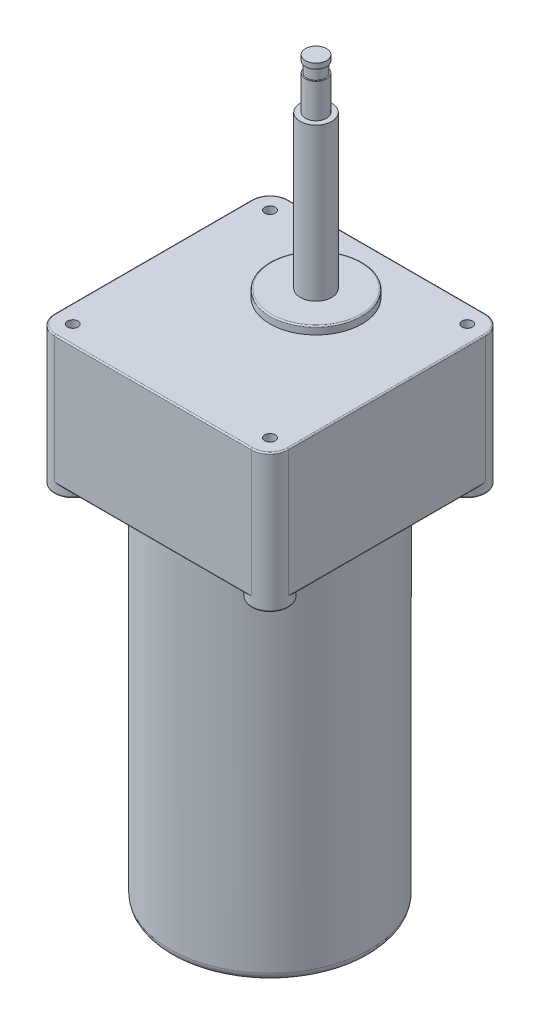
from build123d import *

# Parameters (mm, degrees)
SKETCH1_R           = 38
BOSS_EXTRUDE1_DEPTH = 141
FILLET1_R           = 3
SKETCH2_W           = 89
SKETCH2_H           = 89
BOSS_EXTRUDE2_DEPTH = 49
FILLET2_R           = 7
BOSS_EXTRUDE3_DEPTH = 3.5
FILLET3_R           = 0.5
SKETCH3_R           = 2
CUT_EXTRUDE3_DEPTH  = 201.151192896
SKETCH5_R           = 6
BOSS_EXTRUDE4_DEPTH = 80
SKETCH6_OUTSIDE_W   = 150.58
SKETCH6_OUTSIDE_H   = 150.58
SKETCH6_OUTSIDE_R   = 4
CUT_EXTRUDE4_DEPTH  = 19
SKETCH7_OUTSIDE_W   = 150.58
SKETCH7_OUTSIDE_H   = 150.58
SKETCH7_OUTSIDE_R   = 3.5
CUT_EXTRUDE5_DEPTH  = 4
SKETCH8_R           = 17.5
BOSS_EXTRUDE5_DEPTH = 3
FILLET4_R           = 0.5


with BuildPart() as part:
    # Sketch1 → Boss-Extrude1 (new body)
    with BuildSketch(Plane(origin=(0, 0, 0), x_dir=(1, 0, 0), z_dir=(0, 1, 0))):
        with Locations(Location((0, 0, 0), (0, 0, 270))):
            Circle(SKETCH1_R)
    extrude(amount=BOSS_EXTRUDE1_DEPTH)

    # Fillet1
    fillet1_edges = [part.edges().sort_by_distance(p)[0] for p in [
        (0, 0, -38),
    ]]
    fillet(fillet1_edges, radius=FILLET1_R)

    # Sketch2 → Boss-Extrude2 (add)
    with BuildSketch(Plane(origin=(0, 141, 0), x_dir=(1, 0, 0), z_dir=(0, 1, 0))):
        Rectangle(SKETCH2_W, SKETCH2_H)
    extrude(amount=BOSS_EXTRUDE2_DEPTH)

    # Fillet2
    fillet2_edges = [part.edges().sort_by_distance(p)[0] for p in [
        (44.5, 165.5, 44.5),
        (44.5, 165.5, -44.5),
        (-44.5, 165.5, -44.5),
        (-44.5, 165.5, 44.5),
    ]]
    fillet(fillet2_edges, radius=FILLET2_R)

    # Sketch4 → Boss-Extrude3 (add)
    with BuildSketch(Plane.XZ.offset(-141)):
        with BuildLine():
            Line((-42.449747468, 32.550252532), (-31.359972761, 21.460477824))
            ThreePointArc((-31.359972761, 21.460477824), (-26.870057685, 26.870057685), (-21.460477824, 31.359972761))
            Line((-21.460477824, 31.359972761), (-32.550252532, 42.449747468))
            ThreePointArc((-32.550252532, 42.449747468), (-42.449747468, 42.449747468), (-42.449747468, 32.550252532))
        make_face()
        with BuildLine():
            Line((32.550252532, 42.449747468), (21.460477824, 31.359972761))
            ThreePointArc((21.460477824, 31.359972761), (26.870057685, 26.870057685), (31.359972761, 21.460477824))
            Line((31.359972761, 21.460477824), (42.449747468, 32.550252532))
            ThreePointArc((42.449747468, 32.550252532), (42.449747468, 42.449747468), (32.550252532, 42.449747468))
        make_face()
        with BuildLine():
            Line((42.449747468, -32.550252532), (31.359972761, -21.460477824))
            ThreePointArc((31.359972761, -21.460477824), (26.870057685, -26.870057685), (21.460477824, -31.359972761))
            Line((21.460477824, -31.359972761), (32.550252532, -42.449747468))
            ThreePointArc((32.550252532, -42.449747468), (42.449747468, -42.449747468), (42.449747468, -32.550252532))
        make_face()
        with BuildLine():
            Line((-32.550252532, -42.449747468), (-21.460477824, -31.359972761))
            ThreePointArc((-21.460477824, -31.359972761), (-26.870057685, -26.870057685), (-31.359972761, -21.460477824))
            Line((-31.359972761, -21.460477824), (-42.449747468, -32.550252532))
            ThreePointArc((-42.449747468, -32.550252532), (-42.449747468, -42.449747468), (-32.550252532, -42.449747468))
        make_face()
    extrude(amount=BOSS_EXTRUDE3_DEPTH)

    # Fillet3
    # the kernel refuses this fillet: 0.5 mm, written as the material it takes off along each edge
    with BuildSketch(Plane(origin=(44.5, 141, -38.75), x_dir=(0, 1, 0), z_dir=(0, 0, 1))) as fillet3_piece_1_section:
        with BuildLine():
            CenterArc((FILLET3_R, FILLET3_R), FILLET3_R, 180, 90)
            Line((0, FILLET3_R), (0, 0))
            Line((0, 0), (FILLET3_R, 0))
        make_face()
    fillet3_piece_1 = extrude(amount=77.5, mode=Mode.PRIVATE)
    fillet3_piece_1 = fillet3_piece_1 - Plane(origin=(37.5, 141.115144567, 37.5), x_dir=(0, 0, 1), z_dir=(0, 1, 0)) * Cylinder(7, 157, mode=Mode.PRIVATE)
    fillet3_piece_1 = fillet3_piece_1 - Plane(origin=(37.5, 141.115144567, -37.5), x_dir=(1, 0, 0), z_dir=(0, 1, 0)) * Cylinder(7, 157, mode=Mode.PRIVATE)
    add(fillet3_piece_1, mode=Mode.SUBTRACT)
    with BuildSketch(Plane(origin=(44.5, 190, -37.5), x_dir=(-1, 0, 0), z_dir=(0, 0, 1)), Plane(origin=(-44.5, 190, 37.5), x_dir=(1, 0, 0), z_dir=(0, 0, -1)), Plane(origin=(-37.5, 190, -44.5), x_dir=(0, 0, 1), z_dir=(1, 0, 0))) as fillet3_piece_2:
        with BuildLine():
            CenterArc((FILLET3_R, FILLET3_R), FILLET3_R, 180, 90)
            Line((0, FILLET3_R), (0, 0))
            Line((0, 0), (FILLET3_R, 0))
        make_face()
    extrude(amount=75, mode=Mode.SUBTRACT)
    with BuildSketch(Plane(origin=(-44.5, 141, 38.75), x_dir=(0, 1, 0), z_dir=(0, 0, -1))) as fillet3_piece_3_section:
        with BuildLine():
            CenterArc((FILLET3_R, FILLET3_R), FILLET3_R, 180, 90)
            Line((0, FILLET3_R), (0, 0))
            Line((0, 0), (FILLET3_R, 0))
        make_face()
    fillet3_piece_3 = extrude(amount=77.5, mode=Mode.PRIVATE)
    fillet3_piece_3 = fillet3_piece_3 - Plane(origin=(-37.5, 141.115144625, 37.5), x_dir=(0, 0, 1), z_dir=(0, 1, 0)) * Cylinder(7, 157, mode=Mode.PRIVATE)
    fillet3_piece_3 = fillet3_piece_3 - Plane(origin=(-37.5, 141.115144625, -37.5), x_dir=(-1, 0, 0), z_dir=(0, 1, 0)) * Cylinder(7, 157, mode=Mode.PRIVATE)
    add(fillet3_piece_3, mode=Mode.SUBTRACT)
    with BuildSketch(Plane(origin=(-38.75, 141, -44.5), x_dir=(0, 1, 0), z_dir=(1, 0, 0))) as fillet3_piece_4_section:
        with BuildLine():
            CenterArc((FILLET3_R, FILLET3_R), FILLET3_R, 180, 90)
            Line((0, FILLET3_R), (0, 0))
            Line((0, 0), (FILLET3_R, 0))
        make_face()
    fillet3_piece_4 = extrude(amount=77.5, mode=Mode.PRIVATE)
    fillet3_piece_4 = fillet3_piece_4 - Plane(origin=(37.5, 141.115144428, -37.5), x_dir=(1, 0, 0), z_dir=(0, 1, 0)) * Cylinder(7, 157, mode=Mode.PRIVATE)
    fillet3_piece_4 = fillet3_piece_4 - Plane(origin=(-37.5, 141.115144428, -37.5), x_dir=(-1, 0, 0), z_dir=(0, 1, 0)) * Cylinder(7, 157, mode=Mode.PRIVATE)
    add(fillet3_piece_4, mode=Mode.SUBTRACT)
    with BuildSketch(Plane(origin=(38.75, 141, 44.5), x_dir=(0, 1, 0), z_dir=(-1, 0, 0))) as fillet3_piece_5_section:
        with BuildLine():
            CenterArc((FILLET3_R, FILLET3_R), FILLET3_R, 180, 90)
            Line((0, FILLET3_R), (0, 0))
            Line((0, 0), (FILLET3_R, 0))
        make_face()
    fillet3_piece_5 = extrude(amount=77.5, mode=Mode.PRIVATE)
    fillet3_piece_5 = fillet3_piece_5 - Plane(origin=(37.5, 141.115144726, 37.5), x_dir=(0, 0, 1), z_dir=(0, 1, 0)) * Cylinder(7, 157, mode=Mode.PRIVATE)
    fillet3_piece_5 = fillet3_piece_5 - Plane(origin=(-37.5, 141.115144726, 37.5), x_dir=(0, 0, 1), z_dir=(0, 1, 0)) * Cylinder(7, 157, mode=Mode.PRIVATE)
    add(fillet3_piece_5, mode=Mode.SUBTRACT)
    with BuildSketch(Plane(origin=(37.5, 190, 44.5), x_dir=(0, -1, 0), z_dir=(-1, 0, 0))) as fillet3_piece_6:
        with BuildLine():
            CenterArc((FILLET3_R, -FILLET3_R), FILLET3_R, 90, 90)
            Line((0, -FILLET3_R), (0, 0))
            Line((0, 0), (FILLET3_R, 0))
        make_face()
    extrude(amount=75, mode=Mode.SUBTRACT)
    with BuildSketch(Plane(origin=(-37.5, 190, -37.5), x_dir=(-1, 0, 0), z_dir=(0, 0, 1))) as fillet3_piece_7:
        with BuildLine():
            CenterArc((7 - FILLET3_R, FILLET3_R), FILLET3_R, 270, 90)
            Line((7, FILLET3_R), (7, 0))
            Line((7, 0), (7 - FILLET3_R, 0))
        make_face()
    revolve(axis=Axis((-37.5, 190, -37.5), (0, -1, 0)), revolution_arc=90, mode=Mode.SUBTRACT)
    with BuildSketch(Plane(origin=(-37.5, 190, 37.5), x_dir=(0, 0, 1), z_dir=(1, 0, 0))) as fillet3_piece_8:
        with BuildLine():
            CenterArc((7 - FILLET3_R, FILLET3_R), FILLET3_R, 270, 90)
            Line((7 - FILLET3_R, 0), (7, 0))
            Line((7, 0), (7, FILLET3_R))
        make_face()
    revolve(axis=Axis((-37.5, 190, 37.5), (0, -1, 0)), revolution_arc=90, mode=Mode.SUBTRACT)
    with BuildSketch(Plane(origin=(37.5, 190, -37.5), x_dir=(1, 0, 0), z_dir=(0, 0, 1))) as fillet3_piece_9:
        with BuildLine():
            CenterArc((7 - FILLET3_R, -FILLET3_R), FILLET3_R, 0, 90)
            Line((7, -FILLET3_R), (7, 0))
            Line((7, 0), (7 - FILLET3_R, 0))
        make_face()
    revolve(axis=Axis((37.5, 190, -37.5), (0, 1, 0)), revolution_arc=90, mode=Mode.SUBTRACT)
    with BuildSketch(Plane(origin=(37.5, 190, 37.5), x_dir=(0, 0, 1), z_dir=(-1, 0, 0))) as fillet3_piece_10:
        with BuildLine():
            CenterArc((7 - FILLET3_R, -FILLET3_R), FILLET3_R, 0, 90)
            Line((7 - FILLET3_R, 0), (7, 0))
            Line((7, 0), (7, -FILLET3_R))
        make_face()
    revolve(axis=Axis((37.5, 190, 37.5), (0, 1, 0)), revolution_arc=90, mode=Mode.SUBTRACT)
    with BuildSketch(Plane(origin=(-20.576594348, 137.5, 30.476089284), x_dir=(0, 1, 0), z_dir=(-0.7071067811865467, 0, 0.7071067811865485))) as fillet3_piece_11_section:
        with BuildLine():
            CenterArc((FILLET3_R, FILLET3_R), FILLET3_R, 180, 90)
            Line((0, FILLET3_R), (0, 0))
            Line((0, 0), (FILLET3_R, 0))
        make_face()
    fillet3_piece_11 = extrude(amount=16.933309795, mode=Mode.PRIVATE)
    fillet3_piece_11 = fillet3_piece_11 - Plane(origin=(0, 137.613277893, 0), x_dir=(0, 0, 1), z_dir=(0, -1, 0)) * Cylinder(38, 36, mode=Mode.PRIVATE)
    add(fillet3_piece_11, mode=Mode.SUBTRACT)
    with BuildSketch(Plane(origin=(-37.5, 137.5, 37.5), x_dir=(0.7071067811865465, 0, 0.7071067811865486), z_dir=(0.7071067811865486, 0, -0.7071067811865465))) as fillet3_piece_12:
        with BuildLine():
            CenterArc((7 - FILLET3_R, -FILLET3_R), FILLET3_R, 0, 90)
            Line((7 - FILLET3_R, 0), (7, 0))
            Line((7, 0), (7, -FILLET3_R))
        make_face()
    revolve(axis=Axis((-37.5, 137.5, 37.5), (0, -1, 0)), revolution_arc=180, mode=Mode.SUBTRACT)
    with BuildSketch(Plane(origin=(-42.449747468, 137.5, 32.550252532), x_dir=(0.7071067811865476, 0, 0.7071067811865476), z_dir=(0.7071067811865476, 0, -0.7071067811865476))) as fillet3_piece_13_section:
        with BuildLine():
            CenterArc((FILLET3_R, -FILLET3_R), FILLET3_R, 90, 90)
            Line((0, -FILLET3_R), (0, 0))
            Line((0, 0), (FILLET3_R, 0))
        make_face()
    fillet3_piece_13 = extrude(amount=16.933309795, mode=Mode.PRIVATE)
    fillet3_piece_13 = fillet3_piece_13 - Plane(origin=(0, 137.613277909, 0), x_dir=(0, 0, 1), z_dir=(0, -1, 0)) * Cylinder(38, 36, mode=Mode.PRIVATE)
    add(fillet3_piece_13, mode=Mode.SUBTRACT)
    with BuildSketch(Plane(origin=(30.476089284, 137.5, 20.576594348), x_dir=(0, 1, 0), z_dir=(0.7071067811865502, 0, 0.7071067811865448))) as fillet3_piece_14_section:
        with BuildLine():
            CenterArc((FILLET3_R, FILLET3_R), FILLET3_R, 180, 90)
            Line((0, FILLET3_R), (0, 0))
            Line((0, 0), (FILLET3_R, 0))
        make_face()
    fillet3_piece_14 = extrude(amount=16.933309795, mode=Mode.PRIVATE)
    fillet3_piece_14 = fillet3_piece_14 - Plane(origin=(0, 137.613277924, 0), x_dir=(0, 0, 1), z_dir=(0, -1, 0)) * Cylinder(38, 36, mode=Mode.PRIVATE)
    add(fillet3_piece_14, mode=Mode.SUBTRACT)
    with BuildSketch(Plane(origin=(37.5, 137.5, 37.5), x_dir=(0.707106781186547, 0, -0.707106781186548), z_dir=(-0.707106781186548, 0, -0.707106781186547))) as fillet3_piece_15:
        with BuildLine():
            CenterArc((7 - FILLET3_R, -FILLET3_R), FILLET3_R, 0, 90)
            Line((7 - FILLET3_R, 0), (7, 0))
            Line((7, 0), (7, -FILLET3_R))
        make_face()
    revolve(axis=Axis((37.5, 137.5, 37.5), (0, -1, 0)), revolution_arc=180, mode=Mode.SUBTRACT)
    with BuildSketch(Plane(origin=(32.550252532, 137.5, 42.449747468), x_dir=(0, 1, 0), z_dir=(-0.7071067811865498, 0, -0.7071067811865452))) as fillet3_piece_16_section:
        with BuildLine():
            CenterArc((FILLET3_R, FILLET3_R), FILLET3_R, 180, 90)
            Line((0, FILLET3_R), (0, 0))
            Line((0, 0), (FILLET3_R, 0))
        make_face()
    fillet3_piece_16 = extrude(amount=16.933309795, mode=Mode.PRIVATE)
    fillet3_piece_16 = fillet3_piece_16 - Plane(origin=(0, 137.61327792, 0), x_dir=(0, 0, 1), z_dir=(0, -1, 0)) * Cylinder(38, 36, mode=Mode.PRIVATE)
    add(fillet3_piece_16, mode=Mode.SUBTRACT)
    with BuildSketch(Plane(origin=(20.576594348, 137.5, -30.476089284), x_dir=(0, 1, 0), z_dir=(0.7071067811865417, 0, -0.7071067811865535))) as fillet3_piece_17_section:
        with BuildLine():
            CenterArc((FILLET3_R, FILLET3_R), FILLET3_R, 180, 90)
            Line((0, FILLET3_R), (0, 0))
            Line((0, 0), (FILLET3_R, 0))
        make_face()
    fillet3_piece_17 = extrude(amount=16.933309795, mode=Mode.PRIVATE)
    fillet3_piece_17 = fillet3_piece_17 - Plane(origin=(0, 137.613277924, 0), x_dir=(0, 0, 1), z_dir=(0, -1, 0)) * Cylinder(38, 36, mode=Mode.PRIVATE)
    add(fillet3_piece_17, mode=Mode.SUBTRACT)
    with BuildSketch(Plane(origin=(37.5, 137.5, -37.5), x_dir=(-0.707106781186552, 0, -0.7071067811865429), z_dir=(-0.7071067811865429, 0, 0.707106781186552))) as fillet3_piece_18:
        with BuildLine():
            CenterArc((7 - FILLET3_R, -FILLET3_R), FILLET3_R, 0, 90)
            Line((7 - FILLET3_R, 0), (7, 0))
            Line((7, 0), (7, -FILLET3_R))
        make_face()
    revolve(axis=Axis((37.5, 137.5, -37.5), (0, -1, 0)), revolution_arc=180, mode=Mode.SUBTRACT)
    with BuildSketch(Plane(origin=(42.449747468, 137.5, -32.550252532), x_dir=(-0.7071067811865527, 0, -0.7071067811865425), z_dir=(-0.7071067811865425, 0, 0.7071067811865527))) as fillet3_piece_19_section:
        with BuildLine():
            CenterArc((FILLET3_R, -FILLET3_R), FILLET3_R, 90, 90)
            Line((0, -FILLET3_R), (0, 0))
            Line((0, 0), (FILLET3_R, 0))
        make_face()
    fillet3_piece_19 = extrude(amount=16.933309795, mode=Mode.PRIVATE)
    fillet3_piece_19 = fillet3_piece_19 - Plane(origin=(0, 137.613277909, 0), x_dir=(0, 0, 1), z_dir=(0, -1, 0)) * Cylinder(38, 36, mode=Mode.PRIVATE)
    add(fillet3_piece_19, mode=Mode.SUBTRACT)
    with BuildSketch(Plane(origin=(-30.476089284, 137.5, -20.576594348), x_dir=(0, 1, 0), z_dir=(-0.7071067811865558, 0, -0.7071067811865392))) as fillet3_piece_20_section:
        with BuildLine():
            CenterArc((FILLET3_R, FILLET3_R), FILLET3_R, 180, 90)
            Line((0, FILLET3_R), (0, 0))
            Line((0, 0), (FILLET3_R, 0))
        make_face()
    fillet3_piece_20 = extrude(amount=16.933309795, mode=Mode.PRIVATE)
    fillet3_piece_20 = fillet3_piece_20 - Plane(origin=(0, 137.613277893, 0), x_dir=(0, 0, 1), z_dir=(0, -1, 0)) * Cylinder(38, 36, mode=Mode.PRIVATE)
    add(fillet3_piece_20, mode=Mode.SUBTRACT)
    with BuildSketch(Plane(origin=(-37.5, 137.5, -37.5), x_dir=(-0.7071067811865425, 0, 0.7071067811865526), z_dir=(0.7071067811865526, 0, 0.7071067811865425))) as fillet3_piece_21:
        with BuildLine():
            CenterArc((7 - FILLET3_R, -FILLET3_R), FILLET3_R, 0, 90)
            Line((7 - FILLET3_R, 0), (7, 0))
            Line((7, 0), (7, -FILLET3_R))
        make_face()
    revolve(axis=Axis((-37.5, 137.5, -37.5), (0, -1, 0)), revolution_arc=180, mode=Mode.SUBTRACT)
    with BuildSketch(Plane(origin=(-32.550252532, 137.5, -42.449747468), x_dir=(-0.7071067811865404, 0, 0.7071067811865548), z_dir=(0.7071067811865548, 0, 0.7071067811865402))) as fillet3_piece_22_section:
        with BuildLine():
            CenterArc((FILLET3_R, -FILLET3_R), FILLET3_R, 90, 90)
            Line((0, -FILLET3_R), (0, 0))
            Line((0, 0), (FILLET3_R, 0))
        make_face()
    fillet3_piece_22 = extrude(amount=16.933309795, mode=Mode.PRIVATE)
    fillet3_piece_22 = fillet3_piece_22 - Plane(origin=(0, 137.613277909, 0), x_dir=(0, 0, 1), z_dir=(0, -1, 0)) * Cylinder(38, 36, mode=Mode.PRIVATE)
    add(fillet3_piece_22, mode=Mode.SUBTRACT)

    # Sketch3 → Cut-Extrude3 (cut, through all)
    with BuildSketch(Plane(origin=(0, 190, 0), x_dir=(1, 0, 0), z_dir=(0, 1, 0))):
        with Locations(Location((-37.5, 37.5, 0), (0, 0, 270))):
            Circle(SKETCH3_R)
        with Locations(Location((37.5, 37.5, 0), (0, 0, 90))):
            Circle(SKETCH3_R)
        with Locations(Location((37.5, -37.5, 0), (0, 0, 270))):
            Circle(SKETCH3_R)
        with Locations(Location((-37.5, -37.5, 0), (0, 0, 90))):
            Circle(SKETCH3_R)
    extrude(amount=-CUT_EXTRUDE3_DEPTH, mode=Mode.SUBTRACT)

    # Sketch5 → Boss-Extrude4 (add)
    with BuildSketch(Plane(origin=(0, 190, 0), x_dir=(1, 0, 0), z_dir=(0, 1, 0))):
        with Locations(Location((0, 17.5, 0), (0, 0, 270))):
            Circle(SKETCH5_R)
    extrude(amount=BOSS_EXTRUDE4_DEPTH)

    # Sketch6 outside → Cut-Extrude4 (cut)
    with BuildSketch(Plane(origin=(0, 270, 0), x_dir=(1, 0, 0), z_dir=(0, 1, 0))):
        Rectangle(SKETCH6_OUTSIDE_W, SKETCH6_OUTSIDE_H)
        with Locations(Location((0, 17.5, 0), (0, 0, 270))):
            Circle(SKETCH6_OUTSIDE_R, mode=Mode.SUBTRACT)
    extrude(amount=-CUT_EXTRUDE4_DEPTH, mode=Mode.SUBTRACT)

    # Sketch7 outside → Cut-Extrude5 (cut)
    with BuildSketch(Plane(origin=(0, 268, 0), x_dir=(1, 0, 0), z_dir=(0, 1, 0))):
        Rectangle(SKETCH7_OUTSIDE_W, SKETCH7_OUTSIDE_H)
        with Locations(Location((0, 17.5, 0), (0, 0, 270))):
            Circle(SKETCH7_OUTSIDE_R, mode=Mode.SUBTRACT)
    extrude(amount=-CUT_EXTRUDE5_DEPTH, mode=Mode.SUBTRACT)

    # Sketch8 → Boss-Extrude5 (add)
    with BuildSketch(Plane(origin=(0, 190, 0), x_dir=(1, 0, 0), z_dir=(0, 1, 0))):
        with Locations(Location((0, 17.5, 0), (0, 0, 270))):
            Circle(SKETCH8_R)
    extrude(amount=BOSS_EXTRUDE5_DEPTH)

    # Fillet4
    fillet4_edges = [part.edges().sort_by_distance(p)[0] for p in [
        (0, 193, -35),
    ]]
    fillet(fillet4_edges, radius=FILLET4_R)


solid = part.part
